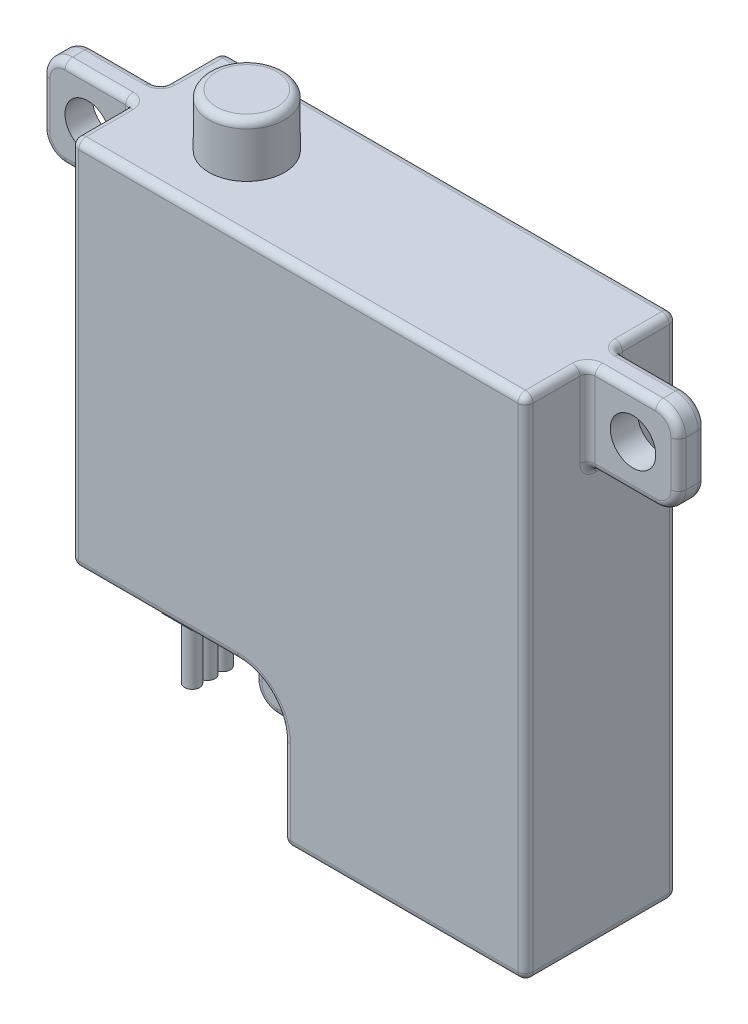
from build123d import *

# Parameters (mm, degrees)
BOSS_EXTRUDE1_DEPTH = 10
SKETCH2_W           = 1.8
SKETCH2_H           = 6
BOSS_EXTRUDE2_DEPTH = 6
SKETCH3_W           = 1.8
SKETCH3_H           = 6
BOSS_EXTRUDE3_DEPTH = 6
SKETCH4_W           = 1.8
SKETCH4_H           = 6
BOSS_EXTRUDE4_DEPTH = 6
SKETCH5_R           = 1.5
CUT_EXTRUDE2_DEPTH  = 6
FILLET1_R           = 0.5
SKETCH6_R           = 2.5
BOSS_EXTRUDE5_DEPTH = 3.5
FILLET2_R           = 0.5
SKETCH7_W           = 3
SKETCH7_H           = 5
BOSS_EXTRUDE6_DEPTH = 0.75
SKETCH9_W           = 2
SKETCH9_H           = 4
BOSS_EXTRUDE7_DEPTH = 2
SKETCH11_R          = 0.5
BOSS_EXTRUDE8_DEPTH = 4


with BuildPart() as part:
    # Sketch1 → Boss-Extrude1 (new body)
    with BuildSketch(Plane.XY):
        with BuildLine():
            Line((0, 0), (16, 0))
            Line((16, 0), (16, 33.5))
            Line((16, 33.5), (-14, 33.5))
            Line((-14, 33.5), (-14, 9))
            Line((-14, 9), (-3, 9))
            ThreePointArc((-3, 9), (-0.878679656, 8.121320344), (0, 6))
            Line((0, 6), (0, 0))
        make_face()
    extrude(amount=BOSS_EXTRUDE1_DEPTH)

    # Sketch2 → Boss-Extrude2 (add)
    with BuildSketch(Plane.ZY.offset(14)):
        with Locations((5, 30.5)):
            Rectangle(SKETCH2_W, SKETCH2_H)
    extrude(amount=BOSS_EXTRUDE2_DEPTH)

    # Sketch3 → Boss-Extrude3 (add)
    with BuildSketch(Plane(origin=(16, 0, 0), x_dir=(0, 0, -1), z_dir=(1, 0, 0))):
        with Locations((-5, 30.5)):
            Rectangle(SKETCH3_W, SKETCH3_H)
    extrude(amount=BOSS_EXTRUDE3_DEPTH)

    # Sketch4 → Boss-Extrude4 (add)
    with BuildSketch(Plane.ZY):
        with Locations((5, 6)):
            Rectangle(SKETCH4_W, SKETCH4_H)
    extrude(amount=BOSS_EXTRUDE4_DEPTH)

    # Sketch5 → Cut-Extrude2 (cut)
    with BuildSketch(Plane.XY.offset(5.9)):
        with BuildLine():
            Line((22, 33.5), (20.5, 33.5))
            ThreePointArc((20.5, 33.5), (21.560660172, 33.060660172), (22, 32))
            Line((22, 32), (22, 33.5))
        make_face()
        with BuildLine():
            ThreePointArc((22, 29), (21.560660172, 27.939339828), (20.5, 27.5))
            Line((20.5, 27.5), (22, 27.5))
            Line((22, 27.5), (22, 29))
        make_face()
        with BuildLine():
            ThreePointArc((-4.5, 3), (-5.560660172, 3.439339828), (-6, 4.5))
            Line((-6, 4.5), (-6, 3))
            Line((-6, 3), (-4.5, 3))
        make_face()
        with Locations((-17, 30.5)):
            Circle(SKETCH5_R)
        with Locations((19, 30.5)):
            Circle(SKETCH5_R)
        with Locations((-3, 6)):
            Circle(SKETCH5_R)
        with BuildLine():
            Line((-20, 33.5), (-20, 32))
            ThreePointArc((-20, 32), (-19.560660172, 33.060660172), (-18.5, 33.5))
            Line((-18.5, 33.5), (-20, 33.5))
        make_face()
        with BuildLine():
            ThreePointArc((-18.5, 27.5), (-19.560660172, 27.939339828), (-20, 29))
            Line((-20, 29), (-20, 27.5))
            Line((-20, 27.5), (-18.5, 27.5))
        make_face()
    extrude(amount=-CUT_EXTRUDE2_DEPTH, mode=Mode.SUBTRACT)

    # Fillet1
    fillet1_edges = [part.edges().sort_by_distance(p)[0] for p in [
        (-6, 9, 5),
        (0, 3, 5),
        (-16.25, 27.5, 5.9),
        (-19.560660172, 27.939339828, 5.9),
        (-20, 30.5, 5.9),
        (-19.560660172, 33.060660172, 5.9),
        (-16.25, 27.5, 4.1),
        (-19.560660172, 27.939339828, 4.1),
        (-20, 30.5, 4.1),
        (-19.560660172, 33.060660172, 4.1),
        (18.25, 27.5, 4.1),
        (21.560660172, 27.939339828, 4.1),
        (22, 30.5, 4.1),
        (21.560660172, 33.060660172, 4.1),
        (18.25, 27.5, 5.9),
        (21.560660172, 27.939339828, 5.9),
        (22, 30.5, 5.9),
        (21.560660172, 33.060660172, 5.9),
        (16, 27.5, 5),
        (16, 30.5, 4.1),
        (16, 30.5, 5.9),
        (-0.878679656, 8.121320344, 10),
        (-8.5, 9, 10),
        (16, 16.75, 10),
        (0, 3, 10),
        (-2.25, 3, 4.1),
        (0, 4.5, 4.1),
        (-0.878679656, 8.121320344, 4.1),
        (-4.5, 9, 4.1),
        (-6, 6.75, 4.1),
        (-5.560660172, 3.439339828, 4.1),
        (-4.5, 6, 4.1),
        (-6, 6.75, 5.9),
        (-4.5, 9, 5.9),
        (-0.878679656, 8.121320344, 5.9),
        (0, 4.5, 5.9),
        (-2.25, 3, 5.9),
        (-5.560660172, 3.439339828, 5.9),
        (-4.5, 6, 5.9),
        (-14, 27.5, 5),
        (-14, 30.5, 5.9),
        (-14, 21.25, 10),
        (-14, 9, 5),
        (-14, 30.5, 4.1),
        (0, 0, 5),
        (8, 0, 10),
        (16, 0, 5),
        (16, 33.5, 7.95),
        (1, 33.5, 10),
        (-14, 33.5, 7.95),
        (-16.25, 33.5, 5.9),
        (-16.25, 33.5, 4.1),
        (-14, 33.5, 2.05),
        (16, 33.5, 2.05),
        (18.25, 33.5, 4.1),
        (18.25, 33.5, 5.9),
        (8, 0, 0),
        (16, 16.75, 0),
        (1, 33.5, 0),
        (-14, 21.25, 0),
        (-8.5, 9, 0),
        (-0.878679656, 8.121320344, 0),
        (0, 3, 0),
    ]]
    fillet(fillet1_edges, radius=FILLET1_R)

    # Sketch6 → Boss-Extrude5 (add)
    with BuildSketch(Plane(origin=(0, 33.5, 0), x_dir=(1, 0, 0), z_dir=(0, 1, 0))):
        with Locations((-7.4, -5)):
            Circle(SKETCH6_R)
    extrude(amount=BOSS_EXTRUDE5_DEPTH)

    # Fillet2
    fillet2_edges = [part.edges().sort_by_distance(p)[0] for p in [
        (-9.9, 37, 5),
    ]]
    fillet(fillet2_edges, radius=FILLET2_R)

    # Sketch7 → Boss-Extrude6 (add)
    with BuildSketch(Plane.XZ.offset(-9)):
        with Locations((-10, 5)):
            Rectangle(SKETCH7_W, SKETCH7_H)
    extrude(amount=BOSS_EXTRUDE6_DEPTH)

    # Sketch9 → Boss-Extrude7 (add)
    with BuildSketch(Plane.XZ.offset(-8.25)):
        with Locations((-10, 5)):
            Rectangle(SKETCH9_W, SKETCH9_H)
    extrude(amount=BOSS_EXTRUDE7_DEPTH)

    # Sketch11 → Boss-Extrude8 (add)
    with BuildSketch(Plane.XZ.offset(-6.25)):
        with Locations((-10, 6.01)):
            Circle(SKETCH11_R)
        with Locations((-10, 5)):
            Circle(SKETCH11_R)
        with Locations((-10, 3.99)):
            Circle(SKETCH11_R)
    extrude(amount=BOSS_EXTRUDE8_DEPTH)


solid = part.part
